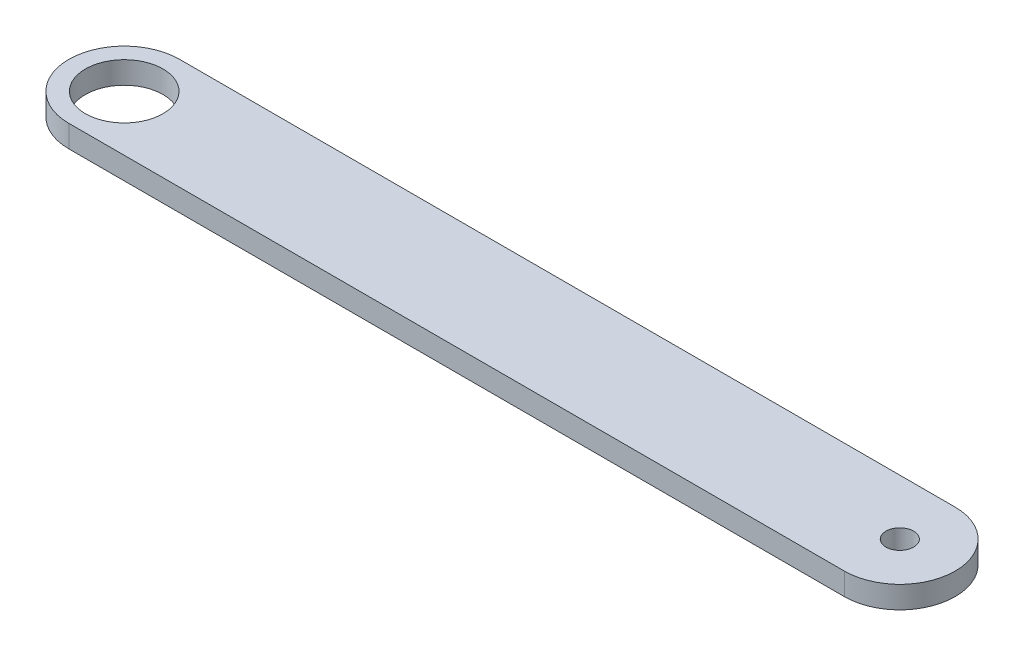
from build123d import *

# Parameters (mm, degrees)
SKETCH1_R           = 2.5
SKETCH1_R_2         = 7
BOSS_EXTRUDE1_DEPTH = 4


with BuildPart() as part:
    # Sketch1 → Boss-Extrude1 (new body)
    with BuildSketch(Plane(origin=(0, 0, 0), x_dir=(1, 0, 0), z_dir=(0, 1, 0))):
        with BuildLine():
            Line((140, 10), (0, 10))
            ThreePointArc((0, 10), (-10, 0), (0, -10))
            Line((0, -10), (140, -10))
            ThreePointArc((140, -10), (150, 0), (140, 10))
        make_face()
        with Locations((140, 0)):
            Circle(SKETCH1_R, mode=Mode.SUBTRACT)
        Circle(SKETCH1_R_2, mode=Mode.SUBTRACT)
    extrude(amount=BOSS_EXTRUDE1_DEPTH)


solid = part.part
